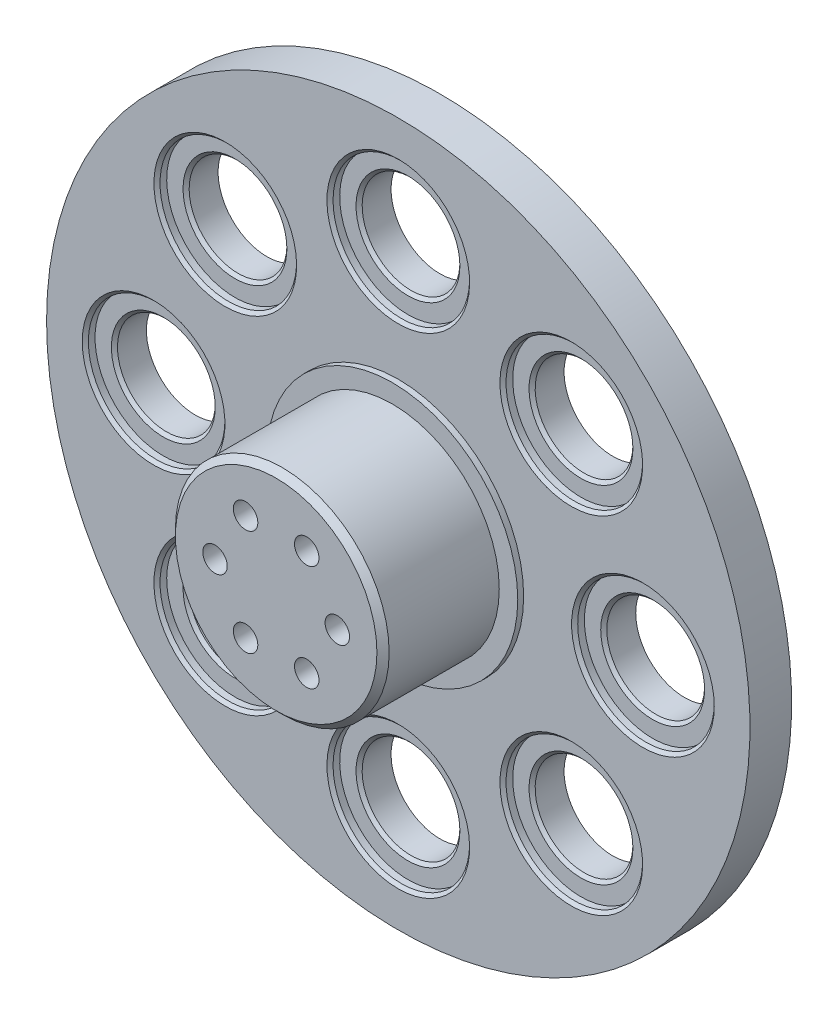
from build123d import *

# Parameters (mm, degrees)
SKETCH1_R                    = 17.475
BOSS_EXTRUDE1_DEPTH          = 19
SKETCH7_R                    = 20.5
BOSS_EXTRUDE3_DEPTH          = 0.9625
SKETCH3_R                    = 57.5
BOSS_EXTRUDE2_DEPTH          = 6.8125
SKETCH4_R                    = 11.0375
CUT_EXTRUDE1_DEPTH           = 7
SKETCH5_R                    = 7.5
CUT_EXTRUDE2_DEPTH           = 0.5
SKETCH6_R                    = 2
CUT_EXTRUDE3_DEPTH           = 10
CIRPATTERN1_COUNT            = 6
CHAMFER1_SIZE                = 1
SKETCH8_R                    = 7.99
CUT_EXTRUDE4_DEPTH           = 84.731722819
SKETCH9_R                    = 11.1625
CUT_EXTRUDE5_DEPTH           = 1.5875
CHAMFER2_SIZE                = 0.5
CHAMFER3_SIZE                = 0.5
CIRPATTERN2_COUNT            = 8
CHAMFER2_OF_CIRPATTERN2_SIZE = 0.5
CHAMFER3_OF_CIRPATTERN2_SIZE = 0.5


with BuildPart() as part:
    # Sketch1 → Boss-Extrude1 (new body)
    with BuildSketch(Plane.XY):
        Circle(SKETCH1_R)
    extrude(amount=BOSS_EXTRUDE1_DEPTH)

    # Sketch7 → Boss-Extrude3 (add)
    with BuildSketch(Plane(origin=(0, 0, 0), x_dir=(-1, 0, 0), z_dir=(0, 0, -1))):
        Circle(SKETCH7_R)
    extrude(amount=BOSS_EXTRUDE3_DEPTH)

    # Sketch3 → Boss-Extrude2 (add)
    with BuildSketch(Plane(origin=(0, 0, -0.9625), x_dir=(-1, 0, 0), z_dir=(0, 0, -1))):
        Circle(SKETCH3_R)
    extrude(amount=BOSS_EXTRUDE2_DEPTH)

    # Sketch4 → Cut-Extrude1 (cut)
    with BuildSketch(Plane(origin=(0, 0, -7.775), x_dir=(-1, 0, 0), z_dir=(0, 0, -1))):
        Circle(SKETCH4_R)
    extrude(amount=-CUT_EXTRUDE1_DEPTH, mode=Mode.SUBTRACT)

    # Sketch5 → Cut-Extrude2 (cut)
    with BuildSketch(Plane(origin=(0, 0, -0.775), x_dir=(-1, 0, 0), z_dir=(0, 0, -1))):
        Circle(SKETCH5_R)
    extrude(amount=-CUT_EXTRUDE2_DEPTH, mode=Mode.SUBTRACT)

    # Sketch6 → Cut-Extrude3 (cut)
    with BuildSketch(Plane.XY.offset(19)):
        with Locations((-10, 0)):
            Circle(SKETCH6_R)
    cut_extrude3 = extrude(amount=-CUT_EXTRUDE3_DEPTH, mode=Mode.SUBTRACT)

    # CirPattern1: Cut-Extrude3 ×6 about axis
    cirpattern1_axis = Axis((0, 0, 19), (0, 0, 1))
    for i in range(1, CIRPATTERN1_COUNT):
        add(cut_extrude3.rotate(cirpattern1_axis, i * 360 / CIRPATTERN1_COUNT), mode=Mode.SUBTRACT)

    # Chamfer1
    chamfer1_edges = [part.edges().sort_by_distance(p)[0] for p in [
        (11.0375, 0, -7.775),
        (-17.475, 0, 19),
    ]]
    chamfer(chamfer1_edges, length=CHAMFER1_SIZE)

    # Sketch8 → Cut-Extrude4 (cut, through all)
    with BuildSketch(Plane.XY.offset(-0.9625)):
        with Locations((-40, 0)):
            Circle(SKETCH8_R)
    cut_extrude4 = extrude(amount=-CUT_EXTRUDE4_DEPTH, mode=Mode.SUBTRACT)

    # Sketch9 → Cut-Extrude5 (cut)
    with BuildSketch(Plane.XY.offset(-0.9625)):
        with Locations((-40, 0)):
            Circle(SKETCH9_R)
    cut_extrude5 = extrude(amount=-CUT_EXTRUDE5_DEPTH, mode=Mode.SUBTRACT)

    # Chamfer2
    chamfer2_edges = [part.edges().sort_by_distance(p)[0] for p in [
        (-47.99, 0, -2.55),
    ]]
    chamfer(chamfer2_edges, length=CHAMFER2_SIZE)

    # Chamfer3
    chamfer3_edges = [part.edges().sort_by_distance(p)[0] for p in [
        (-51.1625, 0, -0.9625),
    ]]
    chamfer(chamfer3_edges, length=CHAMFER3_SIZE)

    # CirPattern2: Cut-Extrude4, Cut-Extrude5 ×8 about axis
    cirpattern2_axis = Axis((0, 0, -0.9625), (0, 0, -1))
    add([cut_extrude4.rotate(cirpattern2_axis, i * 360 / CIRPATTERN2_COUNT) for i in range(1, CIRPATTERN2_COUNT)], mode=Mode.SUBTRACT)
    add([cut_extrude5.rotate(cirpattern2_axis, i * 360 / CIRPATTERN2_COUNT) for i in range(1, CIRPATTERN2_COUNT)], mode=Mode.SUBTRACT)

    # Chamfer2 of CirPattern2
    chamfer2_of_cirpattern2_edges = [part.edges().sort_by_distance(p)[0] for p in [
        (-33.934054429, 33.934054429, -2.55),
        (0, 47.99, -2.55),
        (33.934054429, 33.934054429, -2.55),
        (47.99, 0, -2.55),
        (33.934054429, -33.934054429, -2.55),
        (0, -47.99, -2.55),
        (-33.934054429, -33.934054429, -2.55),
    ]]
    chamfer(chamfer2_of_cirpattern2_edges, length=CHAMFER2_OF_CIRPATTERN2_SIZE)

    # Chamfer3 of CirPattern2
    chamfer3_of_cirpattern2_edges = [part.edges().sort_by_distance(p)[0] for p in [
        (-36.177350692, 36.177350692, -0.9625),
        (0, 51.1625, -0.9625),
        (36.177350692, 36.177350692, -0.9625),
        (51.1625, 0, -0.9625),
        (36.177350692, -36.177350692, -0.9625),
        (0, -51.1625, -0.9625),
        (-36.177350692, -36.177350692, -0.9625),
    ]]
    chamfer(chamfer3_of_cirpattern2_edges, length=CHAMFER3_OF_CIRPATTERN2_SIZE)


solid = part.part
